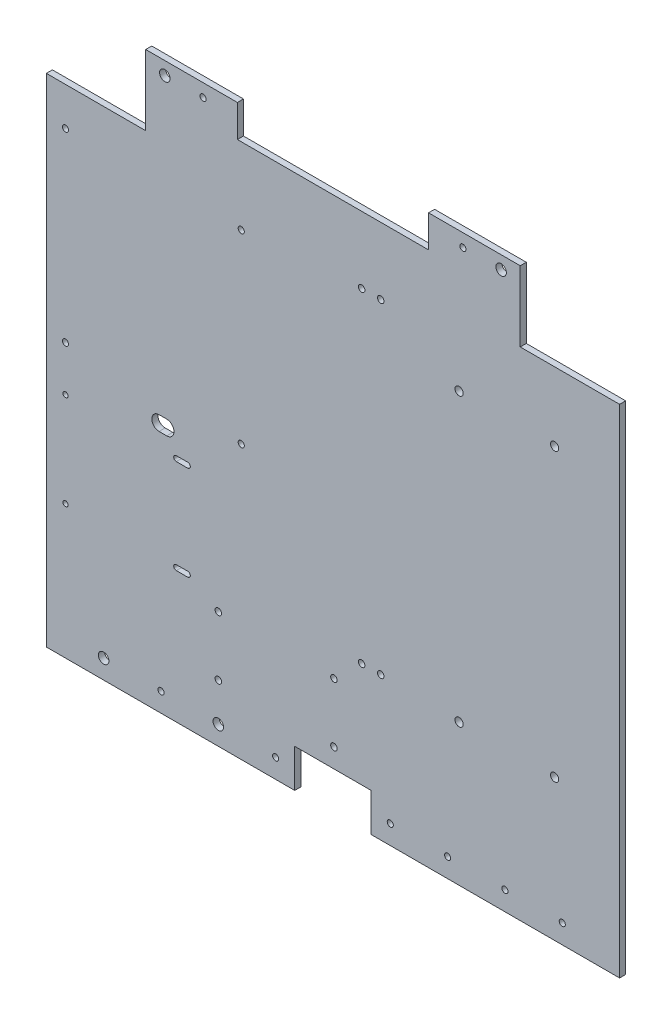
from build123d import *

# Parameters (mm, degrees)
SKETCH1_W                    = 300
SKETCH1_H                    = 300
BOSS_EXTRUDE1_DEPTH          = 3.175
SKETCH2_W                    = 52
SKETCH2_H                    = 40
CUT_EXTRUDE1_DEPTH           = 10
M4_START                     = -3.175
M4_CLEARANCE_HOLE1_OUTLINE_R = 2.15
M4_CLEARANCE_HOLE1_DEPTH     = 3.175
M3_CLEARANCE_HOLE2_D         = 3.2
M2_5_CLEARANCE_HOLE1_D       = 2.7
M3_CLEARANCE_HOLE3_D         = 3.2
M3_CLEARANCE_HOLE4_D         = 3.2
CUT_EXTRUDE3_DEPTH           = 10
CUT_EXTRUDE4_DEPTH           = 10
SKETCH15_W                   = 40
SKETCH15_H                   = 20
CUT_EXTRUDE5_DEPTH           = 10
CUT_EXTRUDE6_START           = -10
CUT_EXTRUDE6_DEPTH           = 10
M3_CLEARANCE_HOLE5_D         = 3.4
M5_CLEARANCE_HOLE1_D         = 5.5
M3_CLEARANCE_HOLE7_D         = 3.4


# Read off the part's stored shape, not the designer's step: M4 Clearance Hole1
with BuildPart() as part:
    # Sketch1 → Boss-Extrude1 (new body)
    with BuildSketch(Plane(origin=(0, 0, 0), x_dir=(1, 0, 0), z_dir=(0, 0, -1))):
        with Locations((150, 150)):
            Rectangle(SKETCH1_W, SKETCH1_H)
    extrude(amount=BOSS_EXTRUDE1_DEPTH)

    # Sketch2 → Cut-Extrude1 (cut)
    with BuildSketch(Plane(origin=(0, 0, -3.175), x_dir=(1, 0, 0), z_dir=(0, 0, -1))):
        with Locations((26, 20)):
            Rectangle(SKETCH2_W, SKETCH2_H)
        with Locations((274, 20)):
            Rectangle(SKETCH2_W, SKETCH2_H)
    extrude(amount=-CUT_EXTRUDE1_DEPTH, mode=Mode.SUBTRACT)

    # M4 Clearance Hole1 outline → M4 Clearance Hole1 (cut)
    with BuildSketch(Plane.XY.offset(M4_START)):
        with Locations((266, -226)):
            Circle(M4_CLEARANCE_HOLE1_OUTLINE_R)
        with Locations((216, -76)):
            Circle(M4_CLEARANCE_HOLE1_OUTLINE_R)
        with Locations((216, -226)):
            Circle(M4_CLEARANCE_HOLE1_OUTLINE_R)
        with Locations((266, -76)):
            Circle(M4_CLEARANCE_HOLE1_OUTLINE_R)
    extrude(amount=M4_CLEARANCE_HOLE1_DEPTH, mode=Mode.SUBTRACT)

    # M3 Clearance Hole2 (through all)
    with Locations(Plane(origin=(0, 0, -3.175), x_dir=(-1, 0, 0), z_dir=(0, 0, -1))):
        with Locations((-102, -60), (-10, -157), (-102, -157), (-10, -60)):
            Hole(M3_CLEARANCE_HOLE2_D / 2)

    # M2.5 Clearance Hole1 (through all)
    with Locations(Plane(origin=(0, 0, -3.175), x_dir=(-1, 0, 0), z_dir=(0, 0, -1))):
        with Locations((-74, -180.6), (-10, -230), (-74, -230), (-10, -180.6), (-68, -230), (-68, -180.6)):
            Hole(M2_5_CLEARANCE_HOLE1_D / 2)

    # M3 Clearance Hole3 (through all)
    with Locations(Plane(origin=(0, 0, -3.175), x_dir=(-1, 0, 0), z_dir=(0, 0, -1))):
        with Locations((-30, -290), (-270, -290), (-240, -290), (-210, -290), (-180, -290), (-150, -290), (-120, -290), (-90, -290), (-60, -290)):
            Hole(M3_CLEARANCE_HOLE3_D / 2)

    # M3 Clearance Hole4 (through all)
    with Locations(Plane(origin=(0, 0, -3.175), x_dir=(-1, 0, 0), z_dir=(0, 0, -1))):
        with Locations((-82, -10), (-238, -10), (-150, -10), (-62, -10), (-218, -10)):
            Hole(M3_CLEARANCE_HOLE4_D / 2)

    # Sketch5 → Cut-Extrude3 (cut)
    with BuildSketch(Plane(origin=(0, 0, -3.175), x_dir=(-1, 0, 0), z_dir=(0, 0, -1))):
        Polygon((-248, 0), (-52, 0), (-52, -3.2), (-100, -3.2), (-100, -20), (-200, -20), (-200, -3.2), (-248, -3.2), align=None)
    extrude(amount=-CUT_EXTRUDE3_DEPTH, mode=Mode.SUBTRACT)

    # Sketch14 → Cut-Extrude4 (cut)
    with BuildSketch(Plane(origin=(0, 0, -3.175), x_dir=(-1, 0, 0), z_dir=(0, 0, -1))):
        with BuildLine():
            Line((-63, -165.2), (-59, -165.2))
            ThreePointArc((-59, -165.2), (-55.2, -169), (-59, -172.8))
            Line((-59, -172.8), (-63, -172.8))
            ThreePointArc((-63, -172.8), (-66.8, -169), (-63, -165.2))
        make_face()
    extrude(amount=-CUT_EXTRUDE4_DEPTH, mode=Mode.SUBTRACT)

    # Sketch15 → Cut-Extrude5 (cut)
    with BuildSketch(Plane(origin=(0, 0, -3.175), x_dir=(-1, 0, 0), z_dir=(0, 0, -1))):
        with Locations((-150, -290)):
            Rectangle(SKETCH15_W, SKETCH15_H)
    extrude(amount=-CUT_EXTRUDE5_DEPTH, mode=Mode.SUBTRACT)

    # Sketch16 → Cut-Extrude6 (cut)
    with BuildSketch(Plane(origin=(0, 0, -3.175), x_dir=(-1, 0, 0), z_dir=(0, 0, -1)).offset(CUT_EXTRUDE6_START)):
        with BuildLine():
            Line((-74, -179.25), (-68, -179.25))
            ThreePointArc((-68, -179.25), (-66.65, -180.6), (-68, -181.95))
            Line((-68, -181.95), (-74, -181.95))
            ThreePointArc((-74, -181.95), (-75.35, -180.6), (-74, -179.25))
        make_face()
        with BuildLine():
            Line((-74, -228.65), (-68, -228.65))
            ThreePointArc((-68, -228.65), (-66.65, -230), (-68, -231.35))
            Line((-68, -231.35), (-74, -231.35))
            ThreePointArc((-74, -231.35), (-75.35, -230), (-74, -228.65))
        make_face()
    extrude(amount=CUT_EXTRUDE6_DEPTH, mode=Mode.SUBTRACT)

    # M3 Clearance Hole5 (through all)
    with Locations(Plane(origin=(0, 0, -3.175), x_dir=(-1, 0, 0), z_dir=(0, 0, -1))):
        with Locations((-175, -55), (-165, -225), (-175, -225), (-165, -55)):
            Hole(M3_CLEARANCE_HOLE5_D / 2)

    # M5 Clearance Hole1 (through all)
    with Locations(Plane(origin=(0, 0, -3.175), x_dir=(-1, 0, 0), z_dir=(0, 0, -1))):
        with Locations((-62, -10), (-90, -290), (-30, -290), (-238, -10)):
            Hole(M5_CLEARANCE_HOLE1_D / 2)

    # M3 Clearance Hole7 (through all)
    with Locations(Plane(origin=(0, 0, -3.175), x_dir=(-1, 0, 0), z_dir=(0, 0, -1))):
        with Locations((-150.5, -239), (-90, -270), (-150.5, -270), (-90, -239)):
            Hole(M3_CLEARANCE_HOLE7_D / 2)


solid = part.part
